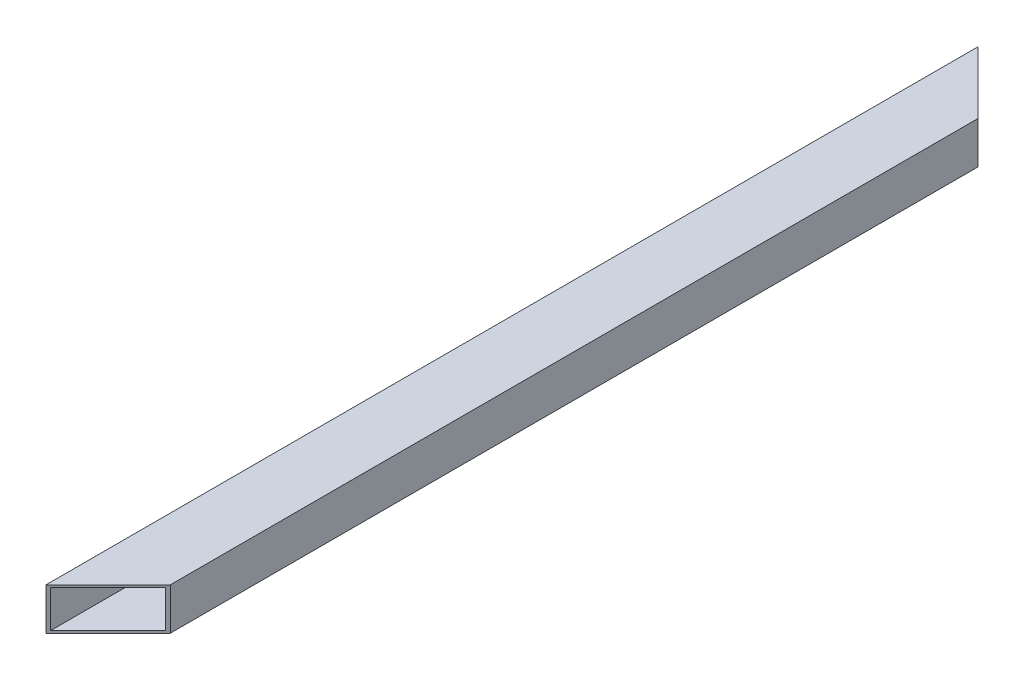
from build123d import *

# Parameters (mm, degrees)
ESQUISSE1_W             = 40
ESQUISSE1_H             = 27
ESQUISSE1_W_2           = 37
ESQUISSE1_H_2           = 24
BOSS_EXTRU_1_DEPTH      = 600
ENL_V_MAT_EXTRU_1_DEPTH = 602.937704418
ENL_V_MAT_EXTRU_3_DEPTH = 602.937704418


with BuildPart() as part:
    # Esquisse1 → Boss.-Extru.1 (new body)
    with BuildSketch(Plane.XY):
        with Locations((20, 13.5)):
            Rectangle(ESQUISSE1_W, ESQUISSE1_H)
        with Locations((20, 13.5)):
            Rectangle(ESQUISSE1_W_2, ESQUISSE1_H_2, mode=Mode.SUBTRACT)
    extrude(amount=BOSS_EXTRU_1_DEPTH)

    # Esquisse2 → Enlèv. mat.-Extru.1 (cut, through all)
    with BuildSketch(Plane(origin=(0, 0, 0), x_dir=(1, 0, 0), z_dir=(0, 1, 0))):
        Polygon((0, -600), (40, -560), (40, -600), align=None)
    extrude(amount=ENL_V_MAT_EXTRU_1_DEPTH, mode=Mode.SUBTRACT)

    # Esquisse4 → Enlèv. mat.-Extru.3 (cut, through all)
    with BuildSketch(Plane(origin=(0, 0, 0), x_dir=(1, 0, 0), z_dir=(0, 1, 0))):
        Polygon((0, 0), (40, -40), (40, 0), align=None)
    extrude(amount=ENL_V_MAT_EXTRU_3_DEPTH, mode=Mode.SUBTRACT)


solid = part.part
